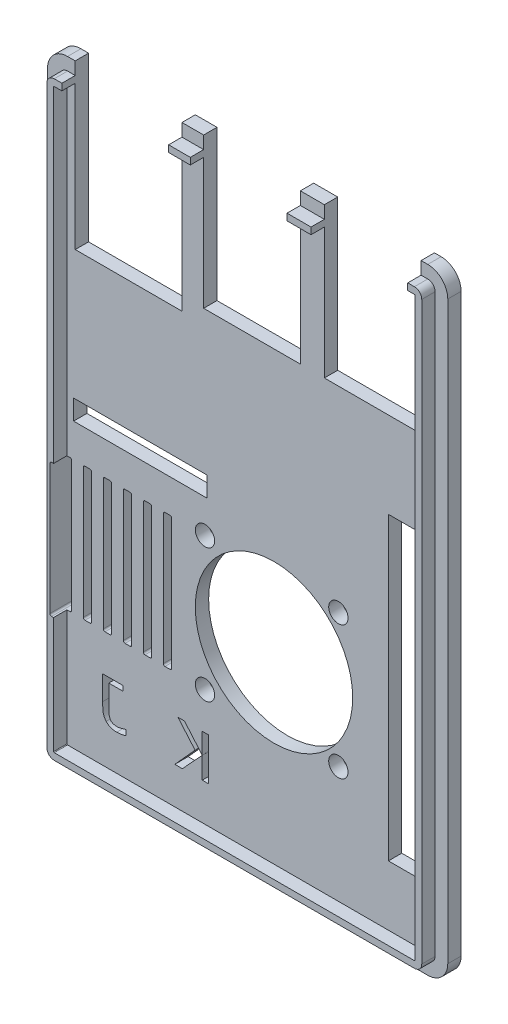
from build123d import *

# Parameters (mm, degrees)
BOSS_EXTRUDE1_DEPTH      = 2
BOSS_EXTRUDE2_DEPTH      = 2
SKETCH3_W                = 14.5
SKETCH3_H                = 22.5
SKETCH3_W_2              = 16
SKETCH3_H_2              = 24.5
CUT_EXTRUDE3_DEPTH       = 22
CUT_EXTRUDE4_DEPTH       = 56.080146151
CUT_EXTRUDE4_DEPTH_BACK  = 56.080146151
SKETCH4_W                = 20
SKETCH4_H                = 3
SKETCH4_W_2              = 6
SKETCH4_H_2              = 45
CUT_EXTRUDE5_START       = -2
CUT_EXTRUDE5_OUTLINE_R   = 1.45
CUT_EXTRUDE5_OUTLINE_R_2 = 11.8
CUT_EXTRUDE5_DEPTH       = 2
CUT_EXTRUDE6_DEPTH       = 10


# Read off the part's stored shape, not the designer's step: Cut-Extrude5
with BuildPart() as part:
    # Sketch1 → Boss-Extrude1 (new body)
    with BuildSketch(Plane.XY):
        with BuildLine():
            Line((-27, 46.15), (27, 46.15))
            ThreePointArc((27, 46.15), (29.121320344, 45.271320344), (30, 43.15))
            Line((30, 43.15), (30, -43.15))
            ThreePointArc((30, -43.15), (29.121320344, -45.271320344), (27, -46.15))
            Line((27, -46.15), (-27, -46.15))
            ThreePointArc((-27, -46.15), (-29.121320344, -45.271320344), (-30, -43.15))
            Line((-30, -43.15), (-30, 43.15))
            ThreePointArc((-30, 43.15), (-29.121320344, 45.271320344), (-27, 46.15))
        make_face()
    extrude(amount=BOSS_EXTRUDE1_DEPTH)

    # Sketch2 → Boss-Extrude2 (add)
    with BuildSketch(Plane.XY.offset(2)):
        with BuildLine():
            Line((27, 44.25), (-27, 44.25))
            ThreePointArc((-27, 44.25), (-27.777817459, 43.927817459), (-28.1, 43.15))
            Line((-28.1, 43.15), (-28.1, -43.15))
            ThreePointArc((-28.1, -43.15), (-27.777817459, -43.927817459), (-27, -44.25))
            Line((-27, -44.25), (27, -44.25))
            ThreePointArc((27, -44.25), (27.777817459, -43.927817459), (28.1, -43.15))
            Line((28.1, -43.15), (28.1, 43.15))
            ThreePointArc((28.1, 43.15), (27.777817459, 43.927817459), (27, 44.25))
        make_face()
        with BuildLine():
            ThreePointArc((-27, 43.25), (-27.070710678, 43.220710678), (-27.1, 43.15))
            Line((-27.1, 43.15), (-27.1, -43.15))
            ThreePointArc((-27.1, -43.15), (-27.070710678, -43.220710678), (-27, -43.25))
            Line((-27, -43.25), (27, -43.25))
            ThreePointArc((27, -43.25), (27.070710678, -43.220710678), (27.1, -43.15))
            Line((27.1, -43.15), (27.1, 43.15))
            ThreePointArc((27.1, 43.15), (27.070710678, 43.220710678), (27, 43.25))
            Line((27, 43.25), (-27, 43.25))
        make_face(mode=Mode.SUBTRACT)
    extrude(amount=BOSS_EXTRUDE2_DEPTH)

    # Sketch3 → Cut-Extrude3 (cut)
    with BuildSketch(Plane(origin=(0, 0, 0), x_dir=(-1, 0, 0), z_dir=(0, 0, -1))):
        with Locations((-18.75, 34.9)):
            Rectangle(SKETCH3_W, SKETCH3_H)
        with Locations((-0.65, 34.9)):
            Rectangle(SKETCH3_W, SKETCH3_H)
        with Locations((17.85, 33.9)):
            Rectangle(SKETCH3_W_2, SKETCH3_H_2)
    extrude(amount=-CUT_EXTRUDE3_DEPTH, mode=Mode.SUBTRACT)

    # Sketch4 → Cut-Extrude4 (cut, two sides: drawn at the far end of the back side and taken through both)
    with BuildSketch(Plane.XY.offset(2).offset(-CUT_EXTRUDE4_DEPTH_BACK)):
        with Locations((-16.1, 0.75)):
            Rectangle(SKETCH4_W, SKETCH4_H)
        with Locations((24.1, -11.75)):
            Rectangle(SKETCH4_W_2, SKETCH4_H_2)
    extrude(amount=CUT_EXTRUDE4_DEPTH + CUT_EXTRUDE4_DEPTH_BACK, mode=Mode.SUBTRACT)

    # Cut-Extrude5 outline → Cut-Extrude5 (cut)
    with BuildSketch(Plane(origin=(0, 0, 0), x_dir=(-1, 0, 0), z_dir=(0, 0, -1)).offset(CUT_EXTRUDE5_START)):
        with BuildLine():
            add(Edge.make_bspline(
                [(19.640299067, -37.908307051), (19.592137674, -37.907171733), (19.49280612, -37.90483017), (19.338386129, -37.8947522), (19.174448175, -37.875236488), (18.999809744, -37.848641297), (18.815389425, -37.815145442), (18.620187948, -37.774180393), (18.415684275, -37.724212075), (18.275990153, -37.687692327), (18.20454539, -37.669014772)],
                knots=[0, 0, 0, 0, 0.099022441, 0.204231076, 0.317949988, 0.438275682, 0.567311582, 0.70319543, 0.848203118, 1, 1, 1, 1], degree=3))
            add(Edge.make_bspline(
                [(21.216126272, -37.27651707), (21.168593718, -37.326797945), (21.074211168, -37.426637672), (20.91289585, -37.555975952), (20.737219463, -37.665900255), (20.546080292, -37.755353838), (20.340194509, -37.82354314), (20.119901387, -37.873417107), (19.884737853, -37.902331429), (19.723060636, -37.906283838), (19.640299067, -37.908307051)],
                knots=[0, 0, 0, 0, 0.118324055, 0.234948998, 0.35275648, 0.472304248, 0.595247441, 0.723290861, 0.8583543, 1, 1, 1, 1], degree=3))
            add(Edge.make_bspline(
                [(21.753074802, -35.003240415), (21.752955393, -35.081550156), (21.752724696, -35.232843812), (21.746429852, -35.452216984), (21.737810002, -35.65602972), (21.726849548, -35.844394273), (21.710459669, -36.017059561), (21.691757379, -36.174240135), (21.67062422, -36.316112831), (21.635815138, -36.482764405), (21.578767811, -36.675433711), (21.484335998, -36.891962959), (21.36549283, -37.095069445), (21.265967104, -37.215971385), (21.216126272, -37.27651707)],
                knots=[0, 0, 0, 0, 0.0982023, 0.189725887, 0.275195929, 0.3540294, 0.426314416, 0.492663486, 0.552530932, 0.60612245, 0.706081988, 0.803872386, 0.901782547, 1, 1, 1, 1], degree=3))
            Line((21.753074802, -35.003240415), (21.753074802, -31.371542345))
            Line((21.753074802, -31.371542345), (18.671457155, -31.371542345))
            Line((18.671457155, -31.371542345), (18.671457155, -32.118601169))
            Line((18.671457155, -32.118601169), (20.819251272, -32.118601169))
            Line((20.819251272, -32.118601169), (20.819251272, -35.521220654))
            add(Edge.make_bspline(
                [(19.581935096, -37.161248228), (19.636948949, -37.160232611), (19.743382421, -37.158267731), (19.896070743, -37.140367431), (20.036476382, -37.113244914), (20.163884072, -37.074127857), (20.278992027, -37.023285196), (20.38035936, -36.959471628), (20.470845394, -36.887065817), (20.546917041, -36.799604249), (20.611619888, -36.697915904), (20.668631774, -36.581164203), (20.714512622, -36.446038224), (20.754098488, -36.295036428), (20.782060471, -36.125441246), (20.80392327, -35.939484469), (20.816975801, -35.735891716), (20.818472608, -35.594680898), (20.819251272, -35.521220654)],
                knots=[0, 0, 0, 0, 0.068968422, 0.13343091, 0.192524476, 0.248087598, 0.300234547, 0.349825294, 0.397934703, 0.44504384, 0.494446671, 0.548732932, 0.60757096, 0.67310952, 0.744307582, 0.822916473, 0.907878168, 1, 1, 1, 1], degree=3))
            add(Edge.make_bspline(
                [(18.525547228, -36.945301536), (18.579427818, -36.962670175), (18.684307752, -36.99647867), (18.838207002, -37.039822383), (18.98374744, -37.076515406), (19.119838203, -37.10744193), (19.247934842, -37.130817422), (19.366587008, -37.148589346), (19.47715191, -37.159687903), (19.547866422, -37.160740912), (19.581935096, -37.161248228)],
                knots=[0, 0, 0, 0, 0.156927511, 0.305463377, 0.443137529, 0.573004086, 0.692275323, 0.80401533, 0.90557896, 1, 1, 1, 1], degree=3))
            Line((18.525547228, -36.945301536), (18.20454539, -36.83878729))
            Line((18.20454539, -36.83878729), (18.20454539, -37.669014772))
        make_face()
        Polygon((5.878074802, -37.721542345), (6.811898331, -37.721542345), (6.811898331, -34.495260176), (9.787001732, -37.721542345), (10.920721861, -37.721542345), (7.884336291, -34.365614036), (10.453810096, -31.371542345), (9.470377192, -31.371542345), (6.811898331, -34.485260176), (6.811898331, -31.371542345), (5.878074802, -31.371542345), align=None)
        with Locations((-13.6, -5.75)):
            Circle(CUT_EXTRUDE5_OUTLINE_R)
        with Locations((-3.948534426, -15.75)):
            Circle(CUT_EXTRUDE5_OUTLINE_R_2)
        with Locations((-13.6, -25.75)):
            Circle(CUT_EXTRUDE5_OUTLINE_R)
        with Locations((6.4, -25.75)):
            Circle(CUT_EXTRUDE5_OUTLINE_R)
        with Locations((6.4, -5.75)):
            Circle(CUT_EXTRUDE5_OUTLINE_R)
    extrude(amount=CUT_EXTRUDE5_DEPTH, mode=Mode.SUBTRACT)

    # Sketch6 → Cut-Extrude6 (cut)
    with BuildSketch(Plane(origin=(0, 0, 0), x_dir=(-1, 0, 0), z_dir=(0, 0, -1))):
        with BuildLine():
            Line((11.642323601, -5.75), (12.392323601, -5.75))
            ThreePointArc((12.392323601, -5.75), (12.569100297, -5.823223305), (12.642323601, -6))
            Line((12.642323601, -6), (12.642323601, -25.5))
            ThreePointArc((12.642323601, -25.5), (12.569100297, -25.676776695), (12.392323601, -25.75))
            Line((12.392323601, -25.75), (11.642323601, -25.75))
            ThreePointArc((11.642323601, -25.75), (11.465546906, -25.676776695), (11.392323601, -25.5))
            Line((11.392323601, -25.5), (11.392323601, -6))
            ThreePointArc((11.392323601, -6), (11.465546906, -5.823223305), (11.642323601, -5.75))
        make_face()
        with BuildLine():
            Line((14.642323601, -5.75), (15.392323601, -5.75))
            ThreePointArc((15.392323601, -5.75), (15.569100297, -5.823223305), (15.642323601, -6))
            Line((15.642323601, -6), (15.642323601, -25.5))
            ThreePointArc((15.642323601, -25.5), (15.569100297, -25.676776695), (15.392323601, -25.75))
            Line((15.392323601, -25.75), (14.642323601, -25.75))
            ThreePointArc((14.642323601, -25.75), (14.465546906, -25.676776695), (14.392323601, -25.5))
            Line((14.392323601, -25.5), (14.392323601, -6))
            ThreePointArc((14.392323601, -6), (14.465546906, -5.823223305), (14.642323601, -5.75))
        make_face()
        with BuildLine():
            Line((17.642323601, -5.75), (18.392323601, -5.75))
            ThreePointArc((18.392323601, -5.75), (18.569100297, -5.823223305), (18.642323601, -6))
            Line((18.642323601, -6), (18.642323601, -25.5))
            ThreePointArc((18.642323601, -25.5), (18.569100297, -25.676776695), (18.392323601, -25.75))
            Line((18.392323601, -25.75), (17.642323601, -25.75))
            ThreePointArc((17.642323601, -25.75), (17.465546906, -25.676776695), (17.392323601, -25.5))
            Line((17.392323601, -25.5), (17.392323601, -6))
            ThreePointArc((17.392323601, -6), (17.465546906, -5.823223305), (17.642323601, -5.75))
        make_face()
        with BuildLine():
            Line((20.642323601, -5.75), (21.392323601, -5.75))
            ThreePointArc((21.392323601, -5.75), (21.569100297, -5.823223305), (21.642323601, -6))
            Line((21.642323601, -6), (21.642323601, -25.5))
            ThreePointArc((21.642323601, -25.5), (21.569100297, -25.676776695), (21.392323601, -25.75))
            Line((21.392323601, -25.75), (20.642323601, -25.75))
            ThreePointArc((20.642323601, -25.75), (20.465546906, -25.676776695), (20.392323601, -25.5))
            Line((20.392323601, -25.5), (20.392323601, -6))
            ThreePointArc((20.392323601, -6), (20.465546906, -5.823223305), (20.642323601, -5.75))
        make_face()
        with BuildLine():
            Line((23.642323601, -5.75), (24.392323601, -5.75))
            ThreePointArc((24.392323601, -5.75), (24.569100297, -5.823223305), (24.642323601, -6))
            Line((24.642323601, -6), (24.642323601, -25.5))
            ThreePointArc((24.642323601, -25.5), (24.569100297, -25.676776695), (24.392323601, -25.75))
            Line((24.392323601, -25.75), (23.642323601, -25.75))
            ThreePointArc((23.642323601, -25.75), (23.465546906, -25.676776695), (23.392323601, -25.5))
            Line((23.392323601, -25.5), (23.392323601, -6))
            ThreePointArc((23.392323601, -6), (23.465546906, -5.823223305), (23.642323601, -5.75))
        make_face()
        with BuildLine():
            Line((26.642323601, -5.75), (27.392323601, -5.75))
            ThreePointArc((27.392323601, -5.75), (27.569100297, -5.823223305), (27.642323601, -6))
            Line((27.642323601, -6), (27.642323601, -25.5))
            ThreePointArc((27.642323601, -25.5), (27.569100297, -25.676776695), (27.392323601, -25.75))
            Line((27.392323601, -25.75), (26.642323601, -25.75))
            ThreePointArc((26.642323601, -25.75), (26.465546906, -25.676776695), (26.392323601, -25.5))
            Line((26.392323601, -25.5), (26.392323601, -6))
            ThreePointArc((26.392323601, -6), (26.465546906, -5.823223305), (26.642323601, -5.75))
        make_face()
    extrude(amount=-CUT_EXTRUDE6_DEPTH, mode=Mode.SUBTRACT)


solid = part.part
